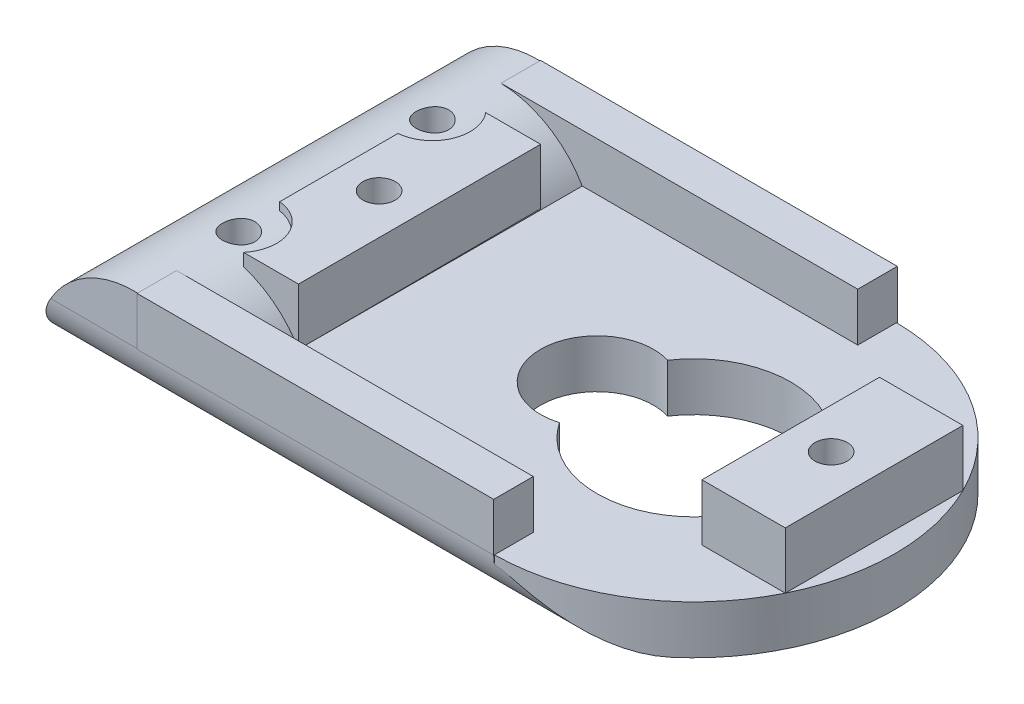
from build123d import *

# Parameters (mm, degrees)
CROQUIS1_R              = 1.00000007
CROQUIS1_R_2            = 1.000000043
CROQUIS1_R_3            = 0.999999659
SALIENTE_EXTRUIR1_DEPTH = 3
SALIENTE_EXTRUIR2_REACH = 34.647
CROQUIS3_W              = 22.095085155
CROQUIS3_H              = 2.45
CROQUIS3_W_2            = 5.163600355
CROQUIS3_H_2            = 11
CROQUIS3_R              = 1
SALIENTE_EXTRUIR3_DEPTH = 3
CROQUIS4_W              = 5.163600355
CROQUIS4_H              = 11
CROQUIS4_R              = 1
SALIENTE_EXTRUIR4_DEPTH = 0.5
CORTAR_EXTRUIR1_DEPTH   = 30.5
CROQUIS6_R              = 1.000000043
CROQUIS6_R_2            = 1.00000007
CROQUIS6_R_3            = 0.999999659
CORTAR_EXTRUIR2_DEPTH   = 30.5
REDONDEO1_R             = 3


with BuildPart() as part:
    # Croquis1 → Saliente-Extruir1 (new body)
    with BuildSketch(Plane(origin=(0, 0, 0), x_dir=(1, 0, 0), z_dir=(0, 1, 0))):
        with BuildLine():
            Line((-20.817493094, 12.573865304), (7.482507574, 12.623865495))
            Line((7.482507574, 12.623865495), (7.482507574, 12.573916185))
            ThreePointArc((7.482507574, 12.573916185), (19.826569133, 0.122006117), (7.482507574, -12.329903951))
            Line((7.482507574, -12.329903951), (7.482507574, -12.376134505))
            Line((7.482507574, -12.376134505), (-20.817493094, -12.326134314))
            Line((-20.817493094, -12.326134314), (-20.817493094, 12.573865304))
        make_face()
        with Locations(Location((-12.11749246, 0.123865663, 0), (0, 0, 270))):
            Circle(CROQUIS1_R, mode=Mode.SUBTRACT)
        with Locations(Location((-14.817492891, 6.123865452, 0), (0, 0, 270))):
            Circle(CROQUIS1_R_2, mode=Mode.SUBTRACT)
        with Locations(Location((-14.817492524, -5.876134505, 0), (0, 0, 270))):
            Circle(CROQUIS1_R_3, mode=Mode.SUBTRACT)
        with BuildLine():
            ThreePointArc((2.403340998, -3.223954765), (13.382507625, 0.123866695), (2.403340083, 3.471685154))
            ThreePointArc((2.403340083, 3.471685154), (-2.117492981, 0.123864576), (2.403340998, -3.223954765))
        make_face(mode=Mode.SUBTRACT)
    extrude(amount=SALIENTE_EXTRUIR1_DEPTH)

    # Saliente-Extruir2: up to this plane
    saliente_extruir2_end = Plane(origin=(-20.817493094, 3, -12.573865304), z_dir=(0.001766788392819182, 0, 0.9999984392281696))
    # Croquis2 → Saliente-Extruir2 (add, up to the surface)
    with BuildSketch(Plane(origin=(-0.02184262, 0, 12.362875885), x_dir=(0.9999984392281696, 0, 0.001766788392856574), z_dir=(-0.001766788392856574, 0, 0.9999984392281696)), mode=Mode.PRIVATE) as saliente_extruir2_sk1:
        with BuildLine():
            Line((-9.599530509, 3), (-19.991835354, 3))
            ThreePointArc((-19.991835354, 3), (-14.795682931, 6), (-9.599530509, 3))
        make_face()
    saliente_extruir2_tool1 = split(extrude(saliente_extruir2_sk1.sketch, amount=-SALIENTE_EXTRUIR2_REACH, mode=Mode.PRIVATE), bisect_by=saliente_extruir2_end, keep=Keep.BOTH, mode=Mode.PRIVATE)
    add(saliente_extruir2_tool1.solids().sort_by_distance((-14.817502, 4.230121, 12.336735))[0])

    # Croquis3 → Saliente-Extruir3 (add)
    # profile 1 of 4: a face of its own
    with BuildSketch(Plane(origin=(0, 3, 0), x_dir=(1, 0, 0), z_dir=(0, 1, 0))):
        with Locations((-3.565035003, -11.151134505)):
            Rectangle(CROQUIS3_W, CROQUIS3_H)
    # profile 2 of 4: a face of its own
    with BuildSketch(Plane(origin=(0, 3, 0), x_dir=(1, 0, 0), z_dir=(0, 1, 0))):
        with Locations((-3.565035003, 11.398865495)):
            Rectangle(CROQUIS3_W, CROQUIS3_H)
    # profile 3 of 4: a face of its own
    with BuildSketch(Plane(origin=(0, 3, 0), x_dir=(1, 0, 0), z_dir=(0, 1, 0))):
        with BuildLine():
            Line((-13.012577984, 7.623865495), (-9.612577581, 7.623865495))
            Line((-9.612577581, 7.623865495), (-9.612577581, -7.376134505))
            Line((-9.612577581, -7.376134505), (-13.012577581, -7.376134505))
            ThreePointArc((-13.012577581, -7.376134505), (-12.651343128, -4.973075952), (-14.612577581, -3.538244886))
            Line((-14.612577581, -3.538244886), (-14.612577581, 3.785975877))
            ThreePointArc((-14.612577581, 3.785975877), (-12.651343414, 5.220807096), (-13.012577984, 7.623865495))
        make_face()
    # profile 4 of 4: a face of its own
    with BuildSketch(Plane(origin=(0, 3, 0), x_dir=(1, 0, 0), z_dir=(0, 1, 0))):
        with Locations((15.964307803, 0.122006117)):
            Rectangle(CROQUIS3_W_2, CROQUIS3_H_2)
        with Locations(Location((15.884187935, 0.123865875, 0), (0, 0, 270))):
            Circle(CROQUIS3_R, mode=Mode.SUBTRACT)
    extrude(amount=SALIENTE_EXTRUIR3_DEPTH)

    # Croquis4 → Saliente-Extruir4 (add)
    # profile 1 of 2: a face of its own
    with BuildSketch(Plane(origin=(0, 6, 0), x_dir=(1, 0, 0), z_dir=(0, 1, 0))):
        with Locations((15.964307803, 0.122006117)):
            Rectangle(CROQUIS4_W, CROQUIS4_H)
        with Locations(Location((15.884187935, 0.123865875, 0), (0, 0, 270))):
            Circle(CROQUIS4_R, mode=Mode.SUBTRACT)
    # profile 2 of 2: a face of its own
    with BuildSketch(Plane(origin=(0, 6, 0), x_dir=(1, 0, 0), z_dir=(0, 1, 0))):
        with BuildLine():
            Line((-13.012577576, -7.376134508), (-9.612577581, -7.376134505))
            Line((-9.612577581, -7.376134505), (-9.612577581, 7.623865495))
            Line((-9.612577581, 7.623865495), (-13.012577984, 7.623865495))
            ThreePointArc((-13.012577984, 7.623865495), (-12.651343414, 5.220807096), (-14.612577581, 3.785975877))
            Line((-14.612577581, 3.785975877), (-14.612577581, -3.538244892))
            ThreePointArc((-14.612577581, -3.538244892), (-12.651343124, -4.97307595), (-13.012577576, -7.376134508))
        make_face()
    extrude(amount=SALIENTE_EXTRUIR4_DEPTH)

    # Croquis5 → Cortar-Extruir1 (cut)
    with BuildSketch(Plane(origin=(-0.02184262, 0, 12.362875885), x_dir=(0.9999984392281696, 0, 0.001766788392856574), z_dir=(-0.001766788392856574, 0, 0.9999984392281696))):
        with BuildLine():
            ThreePointArc((-19.991835354, 3), (-17.725768159, 5.235895392), (-14.634858473, 5.997844237))
            Line((-14.634858473, 5.997844237), (-14.634858473, 8.229597487))
            ThreePointArc((-14.634858473, 8.229597487), (-20.558857666, 5.876900228), (-23.026851701, 0))
            Line((-23.026851701, 0), (-20.795682931, 0))
            Line((-20.795682931, 0), (-20.795682931, 3))
            Line((-20.795682931, 3), (-19.991835354, 3))
        make_face()
        with BuildLine():
            ThreePointArc((-20.795682931, 0), (-20.591237889, 1.552914271), (-19.991835354, 3))
            Line((-19.991835354, 3), (-20.795682931, 3))
            Line((-20.795682931, 3), (-20.795682931, 0))
        make_face()
    extrude(amount=-CORTAR_EXTRUIR1_DEPTH, mode=Mode.SUBTRACT)

    # Croquis6 → Cortar-Extruir2 (cut)
    with BuildSketch(Plane.XZ):
        with Locations(Location((-14.817492891, -6.123865452, 0), (0, 0, 270))):
            Circle(CROQUIS6_R)
        with Locations(Location((-12.11749246, -0.123865663, 0), (0, 0, 90))):
            Circle(CROQUIS6_R_2)
        with Locations(Location((-14.817492524, 5.876134505, 0), (0, 0, 270))):
            Circle(CROQUIS6_R_3)
    extrude(amount=-CORTAR_EXTRUIR2_DEPTH, mode=Mode.SUBTRACT)

    # Redondeo1
    redondeo1_edges = [part.edges().sort_by_distance(p)[0] for p in [
        (-6.645496142, 0, -12.598904263),
        (-6.66749276, 0, 12.35113441),
    ]]
    fillet(redondeo1_edges, radius=REDONDEO1_R - 0.0001)  # a hair under: the kernel refuses the full size


solid = part.part
